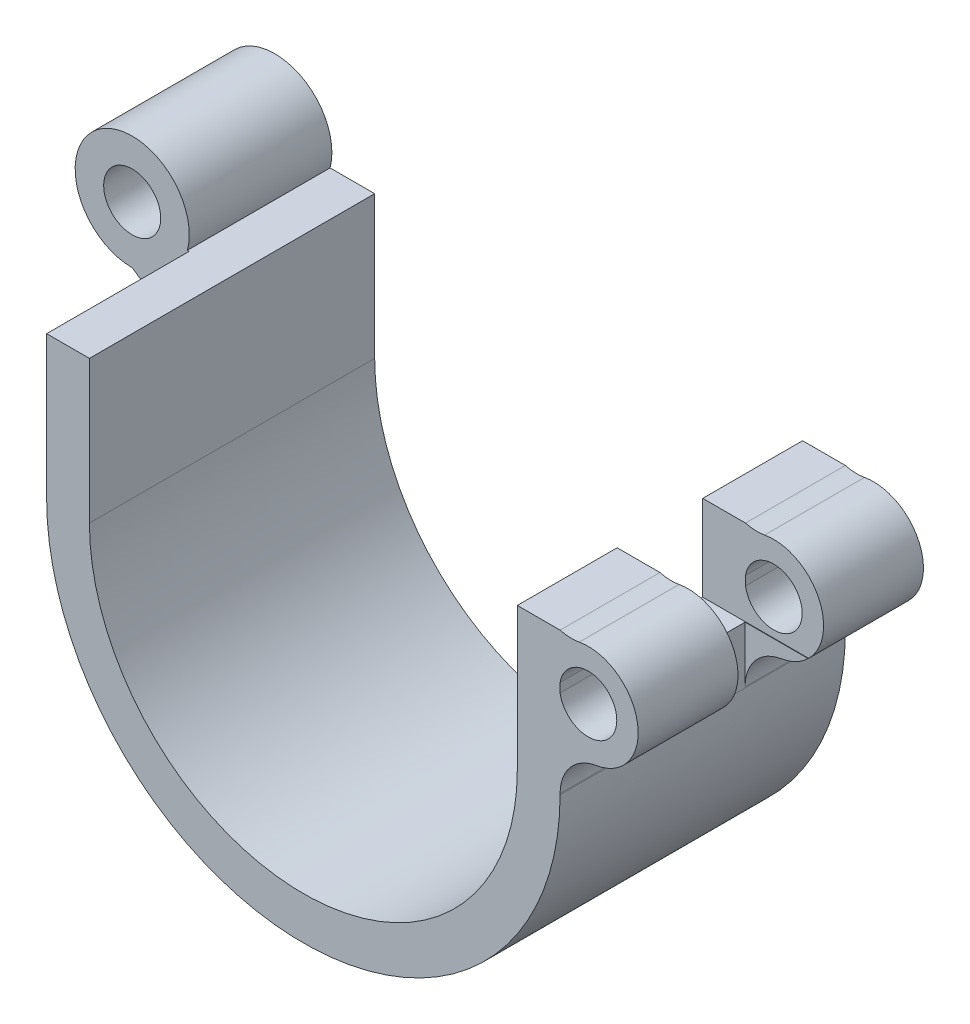
from build123d import *

# Parameters (mm, degrees)
SKETCH1_R                           = 4
SKETCH1_R_2                         = 2
BOSS_EXTRUDE1_DEPTH                 = 10
BOSS_EXTRUDE2_DEPTH                 = 20
BOSS_EXTRUDE3_DEPTH                 = 10
SKETCH5_R                           = 3.5
SKETCH5_R_2                         = 2
BOSS_EXTRUDE4_DEPTH                 = 20
SKETCH4_W                           = 6
SKETCH4_H                           = 6.000142194
CUT_EXTRUDE1_DEPTH                  = 3
CUT_EXTRUDE1_DIRECTION_2_REACH      = 323.185
CUT_EXTRUDE1_DIRECTION_2_END_RADIUS = 3.5
FILLET2_R                           = 3
SKETCH6_W                           = 4.423537042
SKETCH6_H                           = 5.967206981
CUT_EXTRUDE2_DEPTH                  = 36.49639057
BODY_MOVE_COPY1_OUTLINE_R           = 2
BODY_MOVE_COPY1_DEPTH               = 10
BODY_MOVE_COPY1_START               = 2.967206981
BODY_MOVE_COPY1_2_DEPTH             = 0.032793019
BODY_MOVE_COPY1_START_2             = -10
BODY_MOVE_COPY1_3_OUTLINE_R         = 2
BODY_MOVE_COPY1_3_DEPTH             = 10
BODY_MOVE_COPY1_START_3             = -3
BODY_MOVE_COPY1_4_DEPTH             = 0.032793019


# Read off the part's stored shape, not the designer's step: Body-Move/Copy1
with BuildPart() as part:
    # Sketch1 → Boss-Extrude1 (new body)
    with BuildSketch(Plane.XY):
        with Locations(Location((-22, -289, 0), (0, 0, 270))):
            Circle(SKETCH1_R)
        with Locations(Location((-22, -289, 0), (0, 0, 270))):
            Circle(SKETCH1_R_2, mode=Mode.SUBTRACT)
    extrude(amount=BOSS_EXTRUDE1_DEPTH)



with BuildPart() as body_2:
    # Sketch2 → Boss-Extrude2 (new body)
    with BuildSketch(Plane.XY.offset(10)):
        with BuildLine():
            Line((-18, -300), (-18, -295.71047836))
            Line((-18, -295.71047836), (-18, -290))
            Line((-18, -290), (-15, -290))
            Line((-15, -290), (-15, -300))
            ThreePointArc((-15, -300), (0, -315), (15, -300))
            Line((15, -300), (15, -290))
            Line((15, -290), (18, -290))
            Line((18, -290), (18, -300))
            ThreePointArc((18, -300), (0, -318), (-18, -300))
        make_face()
    extrude(amount=-BOSS_EXTRUDE2_DEPTH)


with BuildPart() as part_1:
    add(part.part)

    add(body_2.part)  # Boss-Extrude3 merges body 2
    # Sketch3 → Boss-Extrude3 (add)
    with BuildSketch(Plane.XY.offset(10)):
        Polygon((-18, -290), (-18.290403154, -290), (-22, -293), (-18, -295.669919522), align=None)
    extrude(amount=-BOSS_EXTRUDE3_DEPTH)

    # Sketch5 → Boss-Extrude4 (add)
    with BuildSketch(Plane.XY.offset(10)):
        with Locations((19.974192434, -293.5)):
            Circle(SKETCH5_R)
        with Locations((19.974192434, -293.5)):
            Circle(SKETCH5_R_2, mode=Mode.SUBTRACT)
    extrude(amount=-BOSS_EXTRUDE4_DEPTH)

    # Sketch4 → Cut-Extrude1 (cut)
    with BuildSketch(Plane(origin=(18, 0, 0), x_dir=(0, 0, -1), z_dir=(1, 0, 0))):
        with Locations((0, -293.000071097)):
            Rectangle(SKETCH4_W, SKETCH4_H)
    extrude(amount=-CUT_EXTRUDE1_DEPTH, mode=Mode.SUBTRACT)

    # Cut-Extrude1 direction 2: up to this cylinder (the profile starts inside it)
    cut_extrude1_direction_2_end = Plane(origin=(19.974192434, -293.5, 0), z_dir=(0, 0, 1)) * Cylinder(CUT_EXTRUDE1_DIRECTION_2_END_RADIUS, 654.37, mode=Mode.PRIVATE)
    # Sketch4 → Cut-Extrude1 direction 2 (cut, up to the surface)
    with BuildSketch(Plane(origin=(18, 0, 0), x_dir=(0, 0, -1), z_dir=(1, 0, 0)), mode=Mode.PRIVATE) as cut_extrude1_direction_2_sk1:
        with Locations((0, -293.000071097)):
            Rectangle(SKETCH4_W, SKETCH4_H)
    cut_extrude1_direction_2_tool1 = extrude(cut_extrude1_direction_2_sk1.sketch, amount=CUT_EXTRUDE1_DIRECTION_2_REACH, mode=Mode.PRIVATE) & cut_extrude1_direction_2_end
    add(cut_extrude1_direction_2_tool1.solids().sort_by_distance((18, -293.000071, 0))[0], mode=Mode.SUBTRACT)

    # Fillet2
    # the kernel refuses this fillet: 3 mm, written as the material it adds along each edge
    with BuildSketch(Plane(origin=(18, -290.609919684, -10), x_dir=(1.5610699103436222e-12, 1.0, 0), z_dir=(0, 0, 1)), Plane(origin=(18, -290.609919684, 3), x_dir=(1.5610699103436222e-12, 1.0, 0), z_dir=(0, 0, 1))) as fillet2_piece_1:
        with BuildLine():
            CenterArc((3.502304969, -0.796308584), FILLET2_R, 164.60712684, 25.833288924)
            Line((0.551973299, -1.339947284), (0.492966665, -1.350820058))
            ThreePointArc((0.492966665, -1.350820058), (0.29061984, -0.663945695), (-0.049544234, -0.033843299))
            Line((-0.049544234, -0.033843299), (0, 0.06))
            ThreePointArc((0, 0.06), (0.304959842, 0.06), (0.552071978, 0.015926172))
            Line((0.552071978, 0.015926172), (0.609919684, 0))
        make_face()
    extrude(amount=7)
    with BuildSketch(Plane(origin=(18, -296.390080316, -10), x_dir=(0.975809068162025, -0.21862447825611958, 0), z_dir=(0, 0, 1))) as fillet2_piece_2:
        with BuildLine():
            CenterArc((3.698835937, -2.787234318), FILLET2_R, 111.708438384, 80.919816446)
            Line((0.771408732, -3.443107753), (0.712860188, -3.456225222))
            Line((0.712860188, -3.456225222), (-0.058548544, -0.013117469))
            Line((-0.058548544, -0.013117469), (0.022193016, 0.055744686))
            ThreePointArc((0.022193016, 0.055744686), (1.294592578, -0.188226629), (2.56699214, 0.055744686))
            Line((2.56699214, 0.055744686), (2.589185156, 0))
        make_face()
    extrude(amount=20)

    # Sketch6 → Cut-Extrude2 (cut, through all)
    with BuildSketch(Plane(origin=(0, -296.000142194, 0), x_dir=(1, 0, 0), z_dir=(0, 1, 0))):
        with Locations((20.211768521, 0.016396509)):
            Rectangle(SKETCH6_W, SKETCH6_H)
    extrude(amount=-CUT_EXTRUDE2_DEPTH, mode=Mode.SUBTRACT)

    # Body-Move/Copy1 outline → Body-Move/Copy1 (cut)
    with BuildSketch(Plane.XY):
        with BuildLine():
            Line((-18, -290), (-18.127016654, -290))
            ThreePointArc((-18.127016654, -290), (-24.449489743, -285.83772234), (-22, -293))
            Line((-22, -293), (-18, -295.669919522))
            Line((-18, -295.669919522), (-18, -290))
        make_face()
        with Locations((-22, -289)):
            Circle(BODY_MOVE_COPY1_OUTLINE_R, mode=Mode.SUBTRACT)
    extrude(amount=BODY_MOVE_COPY1_DEPTH, mode=Mode.SUBTRACT)

    # Body-Move_Copy1 2 outline → Body-Move_Copy1 2 (cut)
    with BuildSketch(Plane.XY.offset(BODY_MOVE_COPY1_START)):
        with BuildLine():
            ThreePointArc((20.526550354, -296.95613957), (21.549323306, -296.625533992), (22.423537042, -296.000142194))
            Line((22.423537042, -296.000142194), (18, -296.000142194))
            Line((18, -296.000142194), (18, -299.918544916))
            ThreePointArc((18, -299.918544916), (18.71741934, -297.971797492), (20.526550354, -296.95613957))
        make_face()
    extrude(amount=BODY_MOVE_COPY1_2_DEPTH, mode=Mode.SUBTRACT)

    # Body-Move_Copy1 3 outline → Body-Move_Copy1 3 (add)
    with BuildSketch(Plane.XY.offset(BODY_MOVE_COPY1_START_2)):
        with BuildLine():
            Line((-18, -290), (-18.127016654, -290))
            ThreePointArc((-18.127016654, -290), (-24.449489743, -285.83772234), (-22, -293))
            Line((-22, -293), (-18, -295.669919522))
            Line((-18, -295.669919522), (-18, -290))
        make_face()
        with Locations((-22, -289)):
            Circle(BODY_MOVE_COPY1_3_OUTLINE_R, mode=Mode.SUBTRACT)
    extrude(amount=BODY_MOVE_COPY1_3_DEPTH)

    # Body-Move_Copy1 4 outline → Body-Move_Copy1 4 (add)
    with BuildSketch(Plane.XY.offset(BODY_MOVE_COPY1_START_3)):
        with BuildLine():
            ThreePointArc((20.526550354, -296.95613957), (21.549323306, -296.625533992), (22.423537042, -296.000142194))
            Line((22.423537042, -296.000142194), (18, -296.000142194))
            Line((18, -296.000142194), (18, -299.918544916))
            ThreePointArc((18, -299.918544916), (18.71741934, -297.971797492), (20.526550354, -296.95613957))
        make_face()
    extrude(amount=BODY_MOVE_COPY1_4_DEPTH)


solid = part_1.part
